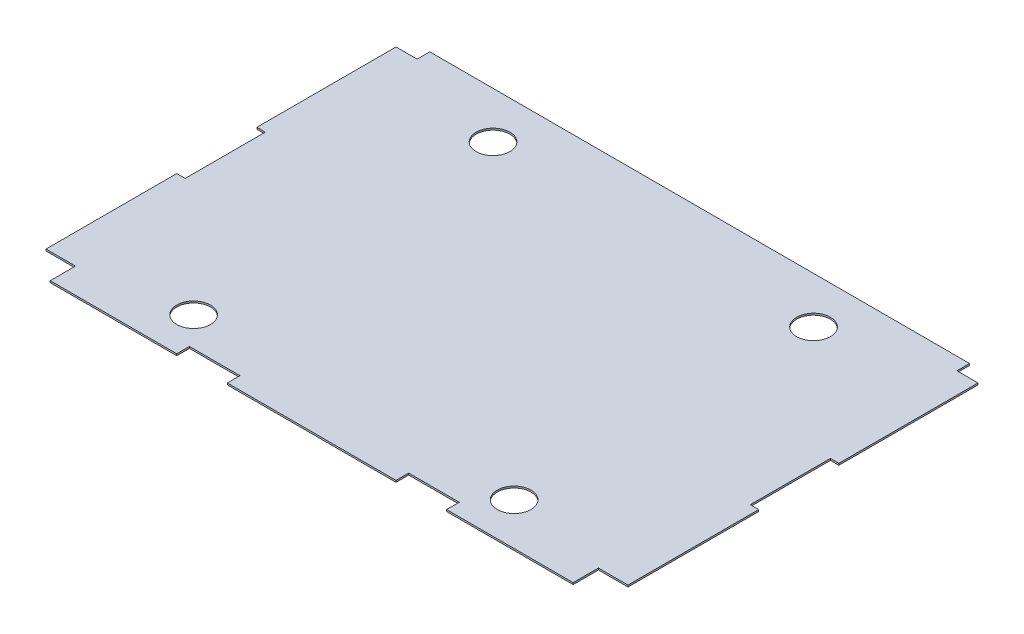
from build123d import *

# Parameters (mm, degrees)
SKETCH1_R           = 25.4
BOSS_EXTRUDE1_DEPTH = 2.65684


with BuildPart() as part:
    # Sketch1 → Boss-Extrude1 (new body)
    with BuildSketch(Plane(origin=(0, 0, 0), x_dir=(1, 0, 0), z_dir=(0, 1, 0))):
        Polygon((-438.15, 273.05), (-406.4, 273.05), (-406.4, 292.1), (406.4, 292.1), (406.4, 273.05), (438.15, 273.05), (438.15, 63.5), (425.45, 63.5), (425.45, -57.15), (438.15, -57.15), (438.15, -254), (393.7, -254), (393.7, -292.1), (203.2, -292.1), (203.2, -273.05), (127, -273.05), (127, -292.1), (-127, -292.1), (-127, -273.05), (-203.2, -273.05), (-203.2, -292.1), (-393.7, -292.1), (-393.7, -254), (-438.15, -254), (-438.15, -57.15), (-425.45, -57.15), (-425.45, 63.5), (-438.15, 63.5), align=None)
        with Locations((241.3, 222.25)):
            Circle(SKETCH1_R, mode=Mode.SUBTRACT)
        with Locations((241.3, -228.6)):
            Circle(SKETCH1_R, mode=Mode.SUBTRACT)
        with Locations((-241.3, 222.25)):
            Circle(SKETCH1_R, mode=Mode.SUBTRACT)
        with Locations((-241.3, -228.6)):
            Circle(SKETCH1_R, mode=Mode.SUBTRACT)
    extrude(amount=BOSS_EXTRUDE1_DEPTH)


solid = part.part
